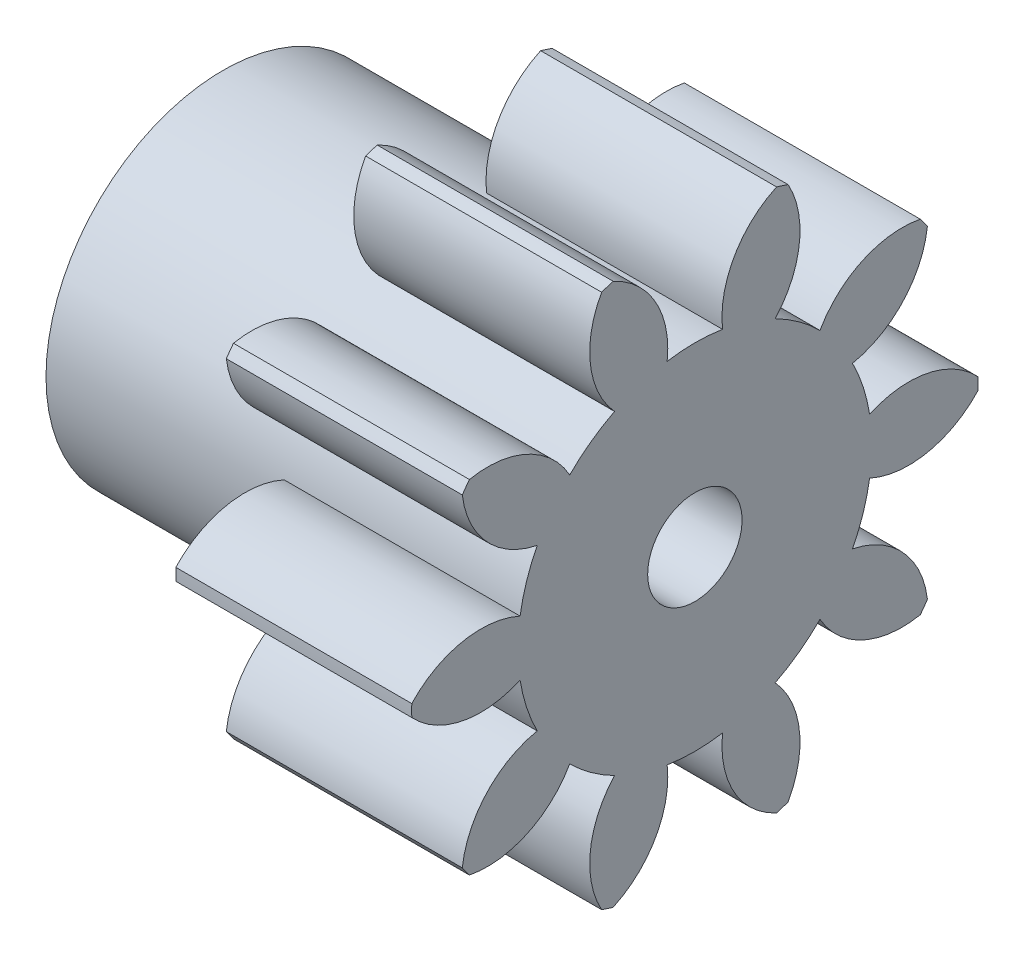
from build123d import *
from build123d.topology import SkipClean

# Parameters (mm, degrees)
BASPROSKE_W      = 10
BASPROSKE_H      = 12
TOOTHCUT_DEPTH   = 20.697715604
TEETHCUTS_COUNT  = 10
TEETHCUTS_ANGLE  = 324
HUBNEARONE_START = 10.0000508
HUBNEAONESKE_R   = 7.499
HUBNEARONE_DEPTH = 10.0000508
BORSKE_R         = 2
BORE_DEPTH       = 20.0000508


with BuildPart() as part:
    # BasProSke → Base-Revolve (revolve)
    with BuildSketch(Plane(origin=(0, 0, 0), x_dir=(1, 0, 0), z_dir=(0, 1, 0))):
        with Locations((5, 6)):
            Rectangle(BASPROSKE_W, BASPROSKE_H)
    revolve(axis=Axis((-10, 0, 0), (1, 0, 0)))

    # TooCutSke → ToothCut (cut, through all)
    with BuildSketch(Plane(origin=(0, 0, 0), x_dir=(0, 0, -1), z_dir=(1, 0, 0))):
        with BuildLine():
            ThreePointArc((1.173662691, 7.406586048), (0, 7.499), (-1.173662691, 7.406586048))
            ThreePointArc((-1.173662691, 7.406586048), (-1.668191438, 9.834565786), (-3.497907776, 11.50542856))
            ThreePointArc((-3.497907776, 11.50542856), (0, 12.0254), (3.497907776, 11.50542856))
            ThreePointArc((3.497907776, 11.50542856), (1.668191438, 9.834565786), (1.173662691, 7.406586048))
        make_face()
    toothcut = extrude(amount=TOOTHCUT_DEPTH, mode=Mode.SUBTRACT)

    # TeethCuts: ToothCut ×10 about axis
    teethcuts_axis = Axis((-10, 0, 0), (1, 0, 0))
    for i in range(1, TEETHCUTS_COUNT):
        add(toothcut.rotate(teethcuts_axis, i * TEETHCUTS_ANGLE / (TEETHCUTS_COUNT - 1)), mode=Mode.SUBTRACT)

    # HubNeaOneSke → HubNearOne (add)
    with SkipClean():  # the faces are left unmerged after this step: merging them gives an invalid solid
        with BuildSketch(Plane.ZY.offset(HUBNEARONE_START)):
            Circle(HUBNEAONESKE_R)
        extrude(amount=-HUBNEARONE_DEPTH)

    # BorSke → Bore (cut, symmetric)
    with SkipClean():  # the faces are left unmerged after this step: merging them gives an invalid solid
        with BuildSketch(Plane(origin=(0, 0, 0), x_dir=(0, 0, -1), z_dir=(1, 0, 0))):
            Circle(BORSKE_R)
        extrude(amount=BORE_DEPTH, both=True, mode=Mode.SUBTRACT)


solid = part.part
